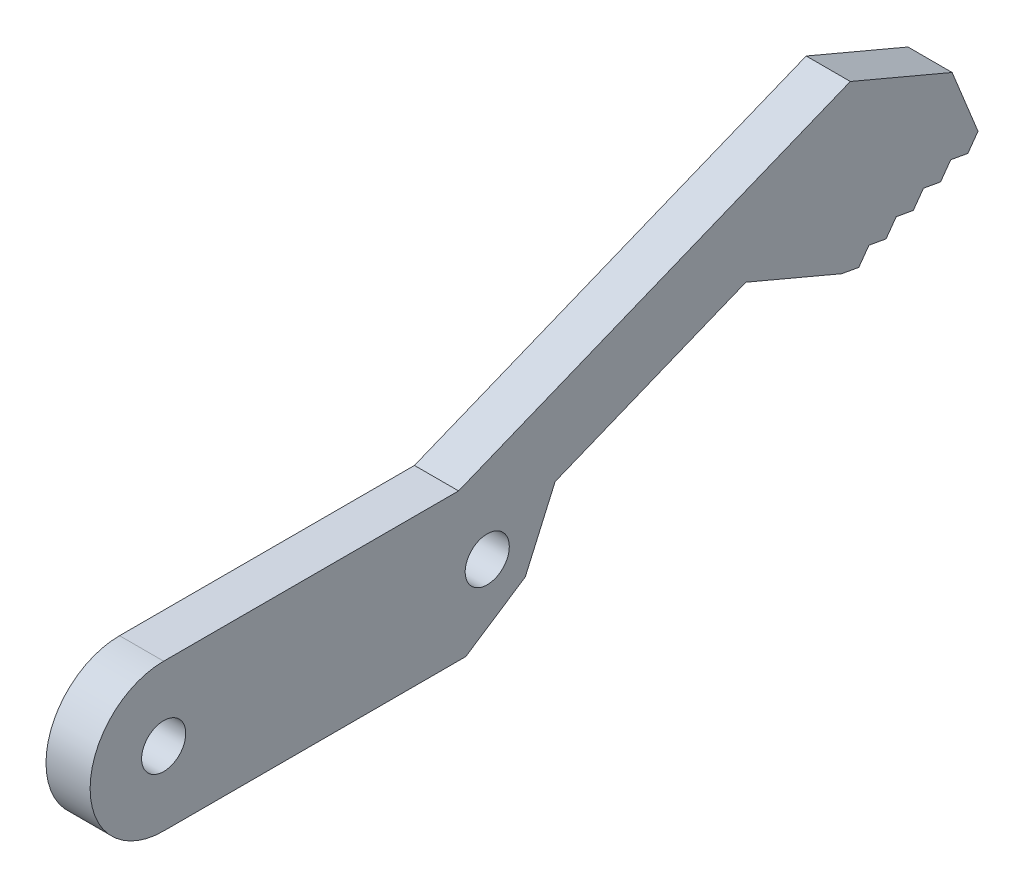
from build123d import *

# Parameters (mm, degrees)
SKETCH1_R             = 5
SKETCH1_R_2           = 1.5
BOSS_EXTRUDE1_DEPTH   = 3
BOSS_EXTRUDE2_START   = -3
BOSS_EXTRUDE2_DEPTH   = 3
CUT_EXTRUDE2_DEPTH    = 65.81382707
CORTAR_EXTRUIR1_DEPTH = 3


# Read off the part's stored shape, not the designer's step: Cortar-Extruir1
with BuildPart() as part:
    # Sketch1 → Boss-Extrude1 (new body)
    # profile 1 of 3: a face of its own
    with BuildSketch(Plane(origin=(0, 0, 0), x_dir=(0, 0, -1), z_dir=(1, 0, 0))):
        with Locations((5, 5)):
            Circle(SKETCH1_R)
        with Locations((5, 5)):
            Circle(SKETCH1_R_2, mode=Mode.SUBTRACT)
    # profile 2 of 3: a face of its own
    with BuildSketch(Plane(origin=(0, 0, 0), x_dir=(0, 0, -1), z_dir=(1, 0, 0))):
        with BuildLine():
            ThreePointArc((10, 5), (8.535533906, 1.464466094), (5, 0))
            Line((5, 0), (27, 0))
            ThreePointArc((27, 0), (22, 5), (27, 10))
            Line((27, 10), (5, 10))
            ThreePointArc((5, 10), (8.535533906, 8.535533906), (10, 5))
        make_face()
    # profile 3 of 3: a face of its own
    with BuildSketch(Plane(origin=(0, 0, 0), x_dir=(0, 0, -1), z_dir=(1, 0, 0))):
        with Locations((27, 5)):
            Circle(SKETCH1_R)
        with Locations((27, 5)):
            Circle(SKETCH1_R_2, mode=Mode.SUBTRACT)
    extrude(amount=BOSS_EXTRUDE1_DEPTH)

    # Sketch2 → Boss-Extrude2 (add)
    with BuildSketch(Plane(origin=(3, 0, 0), x_dir=(0, 0, -1), z_dir=(1, 0, 0)).offset(BOSS_EXTRUDE2_START)):
        with BuildLine():
            ThreePointArc((27, 10), (29.694507461, 9.21184396), (31.53953799, 7.095851816))
            Line((31.53953799, 7.095851816), (31.610157793, 7.262674791))
            Line((31.610157793, 7.262674791), (44.585599673, 12.519851602))
            Line((44.585599673, 12.519851602), (51.097249205, 9.763328363))
            Line((51.097249205, 9.763328363), (60.365421977, 13.518454657))
            Line((60.365421977, 13.518454657), (56.610295683, 22.786627428))
            Line((56.610295683, 22.786627428), (25.051124858, 10))
            Line((25.051124858, 10), (27, 10))
        make_face()
        Polygon((60.365421977, 13.518454657), (51.097249205, 9.763328363), (51.333822162, 9.179433479), (60.601994933, 12.934559772), align=None)
    extrude(amount=BOSS_EXTRUDE2_DEPTH)

    # Sketch4 → Cut-Extrude2 (cut, through all)
    with BuildSketch(Plane(origin=(3, 0, 0), x_dir=(0, 0, -1), z_dir=(1, 0, 0))):
        Polygon((56.610295683, 22.786627428), (51.684261855, 20.790777803), (58.606145308, 17.8605936), align=None)
    extrude(amount=-CUT_EXTRUDE2_DEPTH, mode=Mode.SUBTRACT)

    # Cortar-Extruir1 outline → Cortar-Extruir1 (cut)
    with BuildSketch(Plane.YZ):
        with BuildLine():
            ThreePointArc((0, -27), (2.305492538, -31.21184396), (7.095851816, -31.53953799))
            Line((7.095851816, -31.53953799), (2.664871714, -29.583874941))
            Line((2.664871714, -29.583874941), (0, -25.53953799))
            Line((0, -25.53953799), (0, -27))
        make_face()
        Polygon((13.518454657, -60.365421977), (12.559047143, -59.675177656), (12.934559772, -60.601994933), align=None)
        Polygon((12.767429398, -58.511787422), (11.808021884, -57.821543102), (12.559047143, -59.675177656), align=None)
        Polygon((12.01640414, -56.658152868), (11.056996626, -55.967908548), (11.808021884, -57.821543102), align=None)
        Polygon((11.265378881, -54.804518314), (10.305971367, -54.114273993), (11.056996626, -55.967908548), align=None)
        Polygon((10.514353622, -52.95088376), (9.554946108, -52.260639439), (10.305971367, -54.114273993), align=None)
        Polygon((9.554946108, -52.260639439), (9.763328363, -51.097249205), (9.179433479, -51.333822162), align=None)
    extrude(amount=CORTAR_EXTRUIR1_DEPTH, mode=Mode.SUBTRACT)


solid = part.part
